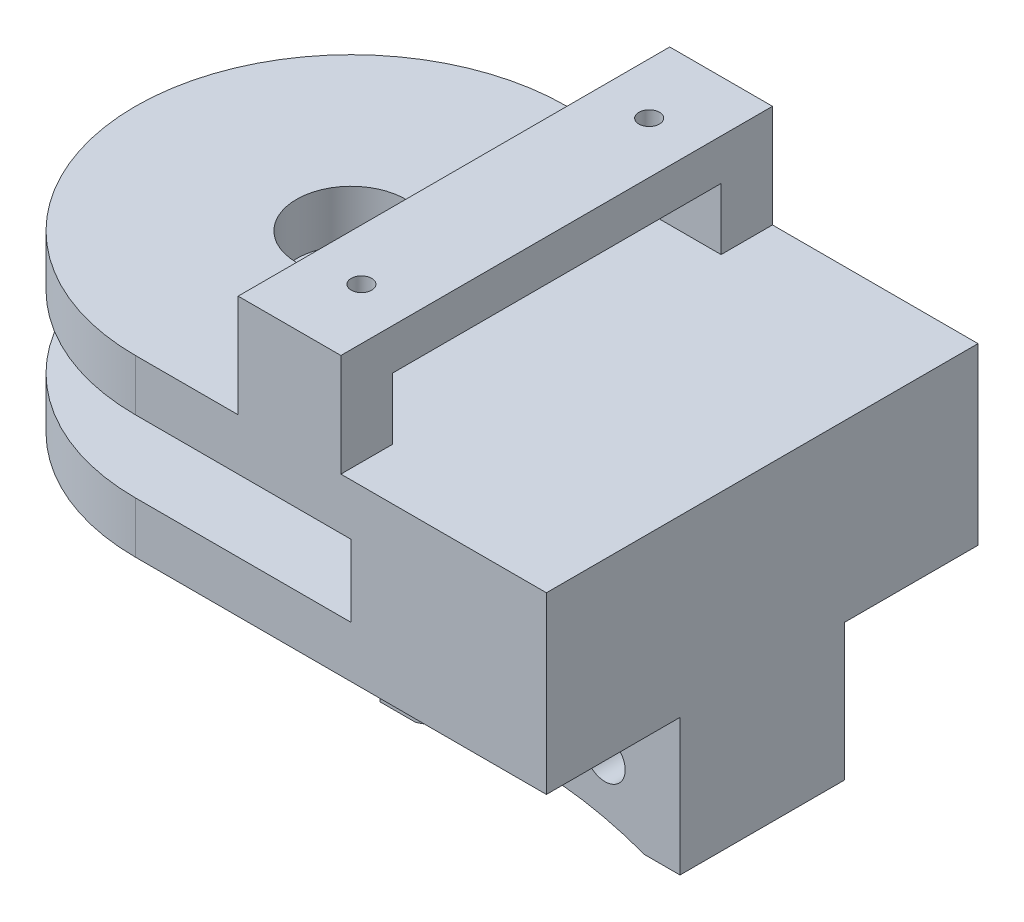
from build123d import *

# Parameters (mm, degrees)
SKETCH1_R           = 3.3782
BOSS_EXTRUDE1_DEPTH = 3.175
BOSS_EXTRUDE2_DEPTH = 4.445
SKETCH7_W           = 18.542
SKETCH7_H           = 10.16
BOSS_EXTRUDE4_DEPTH = 8.43915
SKETCH8_R           = 1.25
CUT_EXTRUDE3_DEPTH  = 36.244411241
SKETCH9_R           = 20.32
CUT_EXTRUDE4_DEPTH  = 36.244411241
SKETCH11_W          = 6.35
SKETCH11_H          = 3.175
BOSS_EXTRUDE8_DEPTH = 3.81
SKETCH14_W          = 6.35
SKETCH14_H          = 26.67
SKETCH14_R          = 0.635
BOSS_EXTRUDE9_DEPTH = 2.54


with BuildPart() as part:
    # Sketch1 → Boss-Extrude1 (new body)
    with BuildSketch(Plane(origin=(0, 0, 0), x_dir=(1, 0, 0), z_dir=(0, 1, 0))):
        with BuildLine():
            ThreePointArc((0, 13.335), (-13.335, 0), (0, -13.335))
            Line((0, -13.335), (25.4, -13.335))
            Line((25.4, -13.335), (25.4, 13.335))
            Line((25.4, 13.335), (0, 13.335))
        make_face()
        Circle(SKETCH1_R, mode=Mode.SUBTRACT)
    boss_extrude1 = extrude(amount=BOSS_EXTRUDE1_DEPTH)

    # Sketch2 → Boss-Extrude2 (add)
    with BuildSketch(Plane(origin=(0, 0, 0), x_dir=(-1, 0, 0), z_dir=(0, -1, 0))):
        Polygon((-25.4, 13.335), (-25.4, -13.335), (-13.335, -13.335), (-13.335, 0), (-13.335, 13.335), align=None)
    extrude(amount=BOSS_EXTRUDE2_DEPTH)

    # Mirror2: Boss-Extrude1 across plane
    add(boss_extrude1.mirror(Plane(origin=(0, -2.2225, 0), x_dir=(0, 0, 1), z_dir=(0, -1, 0))))

    # Sketch7 → Boss-Extrude4 (add)
    with BuildSketch(Plane(origin=(0, -7.62, 0), x_dir=(-1, 0, 0), z_dir=(0, -1, 0))):
        with Locations((-16.129, 0)):
            Rectangle(SKETCH7_W, SKETCH7_H)
    extrude(amount=BOSS_EXTRUDE4_DEPTH)

    # Sketch8 → Cut-Extrude3 (cut, through all)
    with BuildSketch(Plane(origin=(0, 0, -5.08), x_dir=(-1, 0, 0), z_dir=(0, 0, -1))):
        with Locations((-20.7645, -12.1285)):
            Circle(SKETCH8_R)
        with Locations((-11.4935, -12.1285)):
            Circle(SKETCH8_R)
    extrude(amount=-CUT_EXTRUDE3_DEPTH, mode=Mode.SUBTRACT)

    # Sketch9 → Cut-Extrude4 (cut, through all)
    with BuildSketch(Plane(origin=(0, 0, -5.08), x_dir=(-1, 0, 0), z_dir=(0, 0, -1))):
        with Locations((-16.129, -35.10915)):
            Circle(SKETCH9_R)
    extrude(amount=-CUT_EXTRUDE4_DEPTH, mode=Mode.SUBTRACT)

    # Sketch11 → Boss-Extrude8 (add)
    with BuildSketch(Plane(origin=(0, 3.175, 0), x_dir=(1, 0, 0), z_dir=(0, 1, 0))):
        with Locations((9.525, 11.7475)):
            Rectangle(SKETCH11_W, SKETCH11_H)
        with Locations((9.525, -11.7475)):
            Rectangle(SKETCH11_W, SKETCH11_H)
    extrude(amount=BOSS_EXTRUDE8_DEPTH)

    # Sketch14 → Boss-Extrude9 (add)
    with BuildSketch(Plane(origin=(0, 6.985, 0), x_dir=(1, 0, 0), z_dir=(0, 1, 0))):
        with Locations((9.525, 0)):
            Rectangle(SKETCH14_W, SKETCH14_H)
        with Locations((9.525, 8.89)):
            Circle(SKETCH14_R, mode=Mode.SUBTRACT)
        with Locations((9.525, -8.89)):
            Circle(SKETCH14_R, mode=Mode.SUBTRACT)
    extrude(amount=BOSS_EXTRUDE9_DEPTH)


solid = part.part
